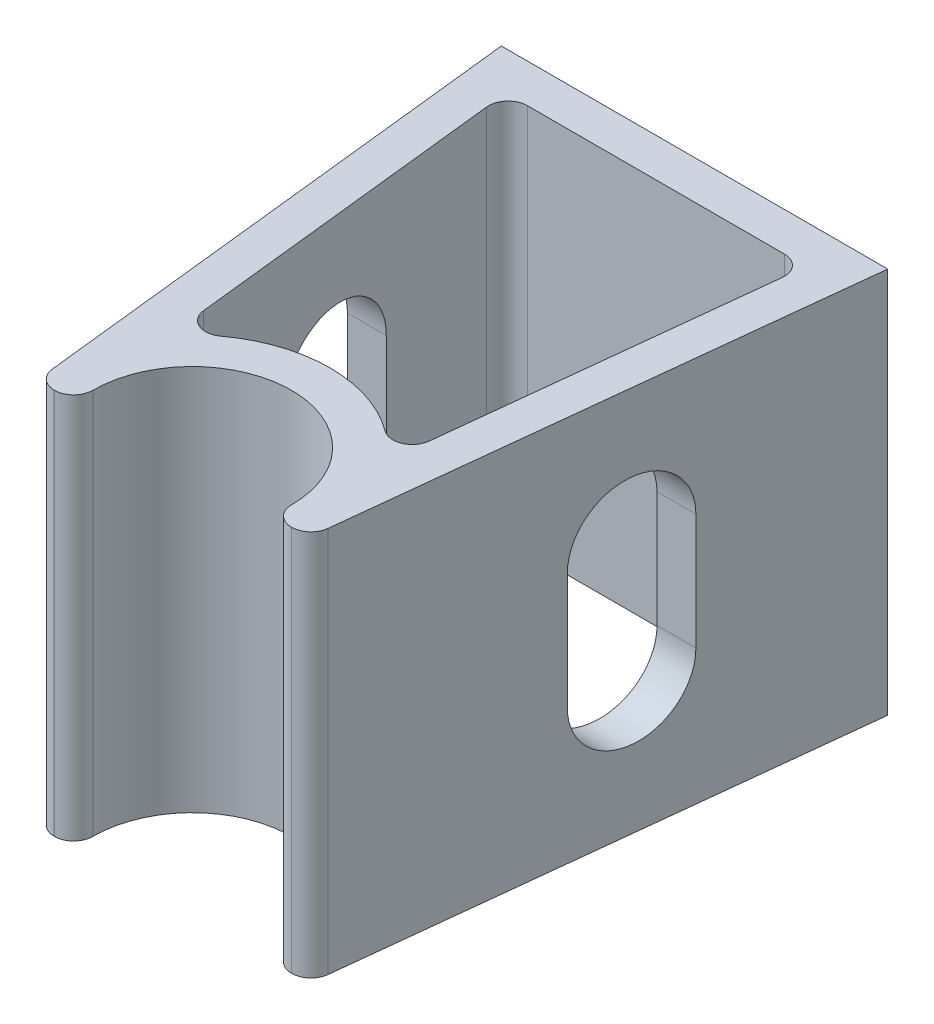
from build123d import *

# Parameters (mm, degrees)
BOSS_EXTRUDE1_DEPTH     = 50
CUT_EXTRUDE1_DEPTH      = 86.732140997
CUT_EXTRUDE1_DEPTH_BACK = 86.732140997
FILLET2_R               = 2.5
CUT_EXTRUDE2_DEPTH      = 86.732140997
CUT_EXTRUDE2_DEPTH_BACK = 86.732140997
SKETCH4_W               = 0.314102564
SKETCH4_H               = 2.557692308
BOSS_EXTRUDE2_DEPTH     = 1


with BuildPart() as part:
    # Sketch1 → Boss-Extrude1 (new body)
    with BuildSketch(Plane(origin=(0, 0, 0), x_dir=(1, 0, 0), z_dir=(0, 1, 0))):
        with BuildLine():
            Line((-12.6, -2.5), (-17.6, -2.5))
            Line((-17.6, -2.5), (-25, 65))
            Line((-25, 65), (25, 65))
            Line((25, 65), (17.6, -2.5))
            Line((17.6, -2.5), (12.6, -2.5))
            ThreePointArc((12.6, -2.5), (0, 12.845621822), (-12.6, -2.5))
        make_face()
    extrude(amount=BOSS_EXTRUDE1_DEPTH)

    # Sketch2 → Cut-Extrude1 (cut, two sides: drawn at the far end of the back side and taken through both)
    with BuildSketch(Plane(origin=(0, 50, 0), x_dir=(1, 0, 0), z_dir=(0, 1, 0)).offset(-CUT_EXTRUDE1_DEPTH_BACK)):
        with BuildLine():
            Line((14.050316299, 11.002491996), (19.421894954, 60))
            Line((19.421894954, 60), (-19.421894954, 60))
            Line((-19.421894954, 60), (-14.050316299, 11.002491996))
            ThreePointArc((-14.050316299, 11.002491996), (0, 17.845621822), (14.050316299, 11.002491996))
        make_face()
    extrude(amount=CUT_EXTRUDE1_DEPTH + CUT_EXTRUDE1_DEPTH_BACK, mode=Mode.SUBTRACT)

    # Fillet2
    fillet2_edges = [part.edges().sort_by_distance(p)[0] for p in [
        (-19.421894954, 25, -60),
        (19.421894954, 25, -60),
        (14.050316299, 25, -11.002491996),
        (-14.050316299, 25, -11.002491996),
        (17.6, 25, 2.5),
        (12.6, 25, 2.5),
        (-17.6, 25, 2.5),
        (-12.6, 25, 2.5),
    ]]
    fillet(fillet2_edges, radius=FILLET2_R)

    # Sketch3 → Cut-Extrude2 (cut, two sides: drawn at the far end of the back side and taken through both)
    with BuildSketch(Plane(origin=(0, 0, 0), x_dir=(0, 0, -1), z_dir=(1, 0, 0)).offset(-CUT_EXTRUDE2_DEPTH_BACK)):
        with BuildLine():
            Line((42.627558228, 32.5), (42.627558228, 17.5))
            ThreePointArc((42.627558228, 17.5), (35.127558228, 10), (27.627558228, 17.5))
            Line((27.627558228, 17.5), (27.627558228, 32.5))
            ThreePointArc((27.627558228, 32.5), (35.127558228, 40), (42.627558228, 32.5))
        make_face()
    extrude(amount=CUT_EXTRUDE2_DEPTH + CUT_EXTRUDE2_DEPTH_BACK, mode=Mode.SUBTRACT)

    # Sketch4 → Boss-Extrude2 (add)
    # profile 1 of 6: a face of its own
    with BuildSketch(Plane(origin=(0, 0, -65), x_dir=(-1, 0, 0), z_dir=(0, 0, -1))):
        Polygon((-5.077449232, 23.149296718), (-4.763346668, 23.149296718), (-4.763346668, 21.073976205), (-3.598783367, 22.117245436), (-3.147962053, 22.117245436), (-4.49832263, 20.905706975), (-3.013346668, 19.559553128), (-3.464167982, 19.559553128), (-4.763346668, 20.738138866), (-4.763346668, 19.559553128), (-5.077449232, 19.559553128), align=None)
    # profile 2 of 6: a face of its own
    with BuildSketch(Plane(origin=(0, 0, -65), x_dir=(-1, 0, 0), z_dir=(0, 0, -1))):
        with BuildLine():
            Line((-0.051808206, 22.117245436), (-0.051808206, 19.559553128))
            Line((-0.051808206, 19.559553128), (-0.365910771, 19.559553128))
            Line((-0.365910771, 19.559553128), (-0.365910771, 20.001960981))
            add(Edge.make_bspline(
                [(-0.365910771, 20.001960981), (-0.401329561, 19.961921387), (-0.470449776, 19.883783616), (-0.585890894, 19.781701443), (-0.708259072, 19.697323122), (-0.836960393, 19.629173206), (-0.971878637, 19.57798115), (-1.112714724, 19.541594991), (-1.259526105, 19.518201156), (-1.35977846, 19.515865134), (-1.410582245, 19.514681334)],
                knots=[0, 0, 0, 0, 1.074387032, 2.096679803, 3.090159297, 4.057316773, 5.018401886, 5.985159533, 6.978961417, 8, 8, 8, 8], degree=3))
            add(Edge.make_bspline(
                [(-1.410582245, 19.514681334), (-1.455750199, 19.515907706), (-1.544823404, 19.518326166), (-1.675852481, 19.53708847), (-1.80194473, 19.567219092), (-1.923219303, 19.609119981), (-2.038891448, 19.664700803), (-2.149951545, 19.731242051), (-2.255824237, 19.810482881), (-2.354895776, 19.901070909), (-2.446127776, 19.999465896), (-2.526189049, 20.104411443), (-2.592942129, 20.215453747), (-2.64876221, 20.331186901), (-2.691758554, 20.452501821), (-2.721732188, 20.578978988), (-2.740472635, 20.710468862), (-2.742890096, 20.800008385), (-2.744115899, 20.8454105)],
                knots=[0, 0, 0, 0, 1.033919861, 2.038935746, 3.024066025, 3.998881131, 4.97069526, 5.957263378, 6.95902576, 7.993208707, 9.027059324, 10.027763471, 11.009749337, 11.988697705, 12.965288445, 13.950418724, 14.960734635, 16, 16, 16, 16], degree=3))
            add(Edge.make_bspline(
                [(-2.744115899, 20.8454105), (-2.742862927, 20.889874204), (-2.740385871, 20.977776547), (-2.721932651, 21.107055245), (-2.690901642, 21.231573506), (-2.647353794, 21.350930449), (-2.591511839, 21.465270499), (-2.523583752, 21.574674524), (-2.443564628, 21.679443922), (-2.351312221, 21.777115149), (-2.251377451, 21.867335763), (-2.14446872, 21.945744808), (-2.033245438, 22.013461657), (-1.915982428, 22.067115133), (-1.794415323, 22.110524238), (-1.667461877, 22.140557206), (-1.535650299, 22.158254527), (-1.446159806, 22.160817291), (-1.40076654, 22.162117231)],
                knots=[0, 0, 0, 0, 1.020392517, 2.01726096, 2.990465484, 3.961182959, 4.928053699, 5.906110375, 6.912531644, 7.948652711, 8.985773172, 9.998621852, 10.987621588, 11.969261332, 12.953316658, 13.946091881, 14.958173133, 16, 16, 16, 16], degree=3))
            add(Edge.make_bspline(
                [(-1.40076654, 22.162117231), (-1.348566681, 22.160679479), (-1.246205221, 22.157860117), (-1.096477211, 22.134397389), (-0.954832734, 22.094758922), (-0.820178382, 22.040841424), (-0.692997695, 21.969192695), (-0.574494711, 21.878812734), (-0.463429228, 21.770271547), (-0.399048936, 21.686901103), (-0.365910771, 21.643988225)],
                knots=[0, 0, 0, 0, 1.038897134, 2.037228247, 3.008116434, 3.962042015, 4.918381754, 5.904844433, 6.921570401, 8, 8, 8, 8], degree=3))
            Line((-0.365910771, 21.643988225), (-0.365910771, 22.117245436))
            Line((-0.365910771, 22.117245436), (-0.051808206, 22.117245436))
        make_face()
        with BuildLine():
            add(Edge.make_bspline(
                [(-1.396559809, 21.848014667), (-1.442474147, 21.846381029), (-1.533101747, 21.843156488), (-1.666145749, 21.817982993), (-1.793459163, 21.776098399), (-1.914405237, 21.718816497), (-2.027073454, 21.646787761), (-2.127767125, 21.559666378), (-2.217309826, 21.459829363), (-2.29261809, 21.347727253), (-2.354008587, 21.227549162), (-2.397175619, 21.101924724), (-2.425644867, 20.973119746), (-2.428553387, 20.88575706), (-2.430013335, 20.841904891)],
                knots=[0, 0, 0, 0, 1.031046209, 2.035121221, 3.029706178, 4.034933723, 5.034054252, 6.02443088, 7.017295772, 8.038157696, 9.050218397, 10.03989886, 11.016116709, 12, 12, 12, 12], degree=3))
            add(Edge.make_bspline(
                [(-2.430013335, 20.841904891), (-2.428148441, 20.798314784), (-2.424425964, 20.711305428), (-2.39767527, 20.582324851), (-2.352795397, 20.456670809), (-2.291553334, 20.335409816), (-2.214866709, 20.222825716), (-2.125978057, 20.121085593), (-2.024027775, 20.033596005), (-1.911100268, 19.960358431), (-1.790492298, 19.90119591), (-1.663658366, 19.860030271), (-1.532982728, 19.83345249), (-1.444130394, 19.830348013), (-1.399364296, 19.828783898)],
                knots=[0, 0, 0, 0, 0.979072187, 1.954306742, 2.945804271, 3.96968567, 4.997920485, 5.998718438, 6.996577872, 8.005894225, 9.015743152, 10.005417472, 10.995077863, 12, 12, 12, 12], degree=3))
            add(Edge.make_bspline(
                [(-1.399364296, 19.828783898), (-1.353917793, 19.830443862), (-1.263529207, 19.833745365), (-1.130090499, 19.859026631), (-1.000595536, 19.900795429), (-0.876808308, 19.958694556), (-0.761492177, 20.030451911), (-0.657994299, 20.114459003), (-0.570478331, 20.212162187), (-0.496285721, 20.31953864), (-0.438110304, 20.437250636), (-0.395734245, 20.562584827), (-0.370680339, 20.695545575), (-0.36752261, 20.786409502), (-0.365910771, 20.832790308)],
                knots=[0, 0, 0, 0, 1.01762866, 2.023962475, 3.030623092, 4.058876274, 5.077231937, 6.066672613, 7.034107872, 8.005628644, 8.981990164, 9.965428785, 10.961468474, 12, 12, 12, 12], degree=3))
            add(Edge.make_bspline(
                [(-0.365910771, 20.832790308), (-0.366870427, 20.868128138), (-0.368759334, 20.937684172), (-0.383189904, 21.039811689), (-0.40614483, 21.137545415), (-0.438491, 21.230988104), (-0.480982285, 21.31962312), (-0.532230051, 21.40408688), (-0.5931355, 21.483940091), (-0.662718196, 21.558083162), (-0.738883399, 21.625709625), (-0.81947794, 21.686073865), (-0.905456687, 21.735662638), (-0.995373723, 21.77670391), (-1.089385058, 21.80936306), (-1.188255678, 21.831150753), (-1.290934665, 21.846111074), (-1.36098072, 21.847373455), (-1.396559809, 21.848014667)],
                knots=[0, 0, 0, 0, 1.050140795, 2.067009409, 3.05949893, 4.030605086, 5.00011959, 5.97591094, 6.962425594, 7.979863591, 8.993523472, 9.986985069, 10.967611495, 11.937549037, 12.921786183, 13.919465291, 14.943216303, 16, 16, 16, 16], degree=3))
        make_face(mode=Mode.SUBTRACT)
    # profile 3 of 6: a face of its own
    with BuildSketch(Plane(origin=(0, 0, -65), x_dir=(-1, 0, 0), z_dir=(0, 0, -1))):
        Polygon((0.307166153, 22.117245436), (0.643704614, 22.117245436), (1.406525127, 20.277501846), (2.240158941, 22.117245436), (2.294145319, 22.117245436), (3.111653332, 20.277501846), (3.880783941, 22.117245436), (4.211012306, 22.117245436), (3.141801569, 19.559553128), (3.077298364, 19.559553128), (2.259089229, 21.399296718), (1.425455415, 19.559553128), (1.367963428, 19.559553128), align=None)
    # profile 4 of 6: a face of its own
    with BuildSketch(Plane(origin=(0, 0, -65), x_dir=(-1, 0, 0), z_dir=(0, 0, -1))):
        with BuildLine():
            add(Edge.make_bspline(
                [(4.725635704, 23.194168513), (4.74512702, 23.193264361), (4.783294759, 23.191493857), (4.838488027, 23.17633238), (4.888745039, 23.150632694), (4.933322772, 23.116153013), (4.971574659, 23.07560357), (4.998355369, 23.028342601), (5.015567765, 22.977283963), (5.017646321, 22.941668873), (5.018704614, 22.9235355)],
                knots=[0, 0, 0, 0, 1.055194115, 2.066272739, 3.074728998, 4.095836921, 5.109056067, 6.073838105, 7.019297344, 8, 8, 8, 8], degree=3))
            add(Edge.make_bspline(
                [(5.018704614, 22.9235355), (5.017622454, 22.905872847), (5.015483152, 22.870955872), (4.998368664, 22.8207824), (4.971346426, 22.774178117), (4.933347301, 22.733707406), (4.88873854, 22.699246786), (4.838489754, 22.673542047), (4.783294305, 22.65838191), (4.745126866, 22.656611221), (4.725635704, 22.655706975)],
                knots=[0, 0, 0, 0, 0.96129708, 1.900370562, 2.859976407, 3.87933698, 4.906634145, 5.921202961, 6.938410037, 8, 8, 8, 8], degree=3))
            add(Edge.make_bspline(
                [(4.725635704, 22.655706975), (4.706367429, 22.656576695), (4.668864248, 22.658269492), (4.614497406, 22.673839509), (4.564668917, 22.699255582), (4.520004244, 22.733481768), (4.482774051, 22.774426665), (4.455675726, 22.820753959), (4.438600764, 22.870963113), (4.436456135, 22.90587528), (4.435371281, 22.9235355)],
                knots=[0, 0, 0, 0, 1.054934014, 2.053291228, 3.073705704, 4.106921865, 5.123545215, 6.088680038, 7.033164197, 8, 8, 8, 8], degree=3))
            add(Edge.make_bspline(
                [(4.435371281, 22.9235355), (4.436432367, 22.94166635), (4.438516408, 22.977276482), (4.455688525, 23.028371515), (4.482548332, 23.075353017), (4.520028896, 23.116378517), (4.564662356, 23.150623951), (4.614499101, 23.176034933), (4.668863801, 23.191606272), (4.706367277, 23.193298887), (4.725635704, 23.194168513)],
                knots=[0, 0, 0, 0, 0.98631895, 1.937192651, 2.907499808, 3.917963147, 4.944918757, 5.95915025, 6.951458133, 8, 8, 8, 8], degree=3))
        make_face()
    # profile 5 of 6: a face of its own
    with BuildSketch(Plane(origin=(0, 0, -65), x_dir=(-1, 0, 0), z_dir=(0, 0, -1))):
        with Locations((4.727037947, 20.838399282)):
            Rectangle(SKETCH4_W, SKETCH4_H)
    # profile 6 of 6: a face of its own
    with BuildSketch(Plane(origin=(0, 0, -65), x_dir=(-1, 0, 0), z_dir=(0, 0, -1))):
        with BuildLine():
            Line((5.646909742, 22.117245436), (5.961012306, 22.117245436))
            Line((5.961012306, 22.117245436), (5.961012306, 21.655907295))
            add(Edge.make_bspline(
                [(5.961012306, 21.655907295), (5.994549942, 21.697750018), (6.059630893, 21.778947281), (6.168015226, 21.885667856), (6.282559126, 21.973613081), (6.40256113, 22.043716875), (6.52818414, 22.096563501), (6.65866241, 22.134729432), (6.794777116, 22.157614261), (6.887341553, 22.160604491), (6.934169358, 22.162117231)],
                knots=[0, 0, 0, 0, 1.12780773, 2.188550248, 3.19190651, 4.159438251, 5.104880172, 6.052711206, 7.014878035, 8, 8, 8, 8], degree=3))
            add(Edge.make_bspline(
                [(6.934169358, 22.162117231), (6.981499992, 22.160372036), (7.07413746, 22.156956267), (7.209015521, 22.129939576), (7.334988915, 22.083794321), (7.45160847, 22.02058225), (7.556735684, 21.941975777), (7.649060535, 21.850397995), (7.725423783, 21.745061912), (7.776621146, 21.647338756), (7.810346793, 21.560649962), (7.831579131, 21.486403211), (7.849610112, 21.40368506), (7.86524186, 21.312745471), (7.875818972, 21.212947281), (7.884161264, 21.104699589), (7.890139958, 20.988037458), (7.890377165, 20.907350831), (7.890499486, 20.865743032)],
                knots=[0, 0, 0, 0, 1.235846778, 2.418850247, 3.575807741, 4.728682307, 5.871620074, 6.994088408, 8.11269785, 9.256955736, 9.865816715, 10.540099792, 11.271859618, 12.076849838, 12.949306005, 13.892391288, 14.913166135, 16, 16, 16, 16], degree=3))
            Line((7.890499486, 20.865743032), (7.890499486, 19.559553128))
            Line((7.890499486, 19.559553128), (7.576396922, 19.559553128))
            Line((7.576396922, 19.559553128), (7.576396922, 20.762678128))
            add(Edge.make_bspline(
                [(7.576396922, 20.762678128), (7.576203714, 20.797500573), (7.57583414, 20.864109984), (7.574668493, 20.959479007), (7.571858686, 21.045965586), (7.567910373, 21.123362953), (7.562131343, 21.19159679), (7.556108712, 21.250806066), (7.548743735, 21.300915609), (7.542180822, 21.331080691), (7.539237467, 21.344609218)],
                knots=[0, 0, 0, 0, 1.430800155, 2.736877192, 3.918605307, 4.986035426, 5.920637409, 6.731861385, 7.431261377, 8, 8, 8, 8], degree=3))
            add(Edge.make_bspline(
                [(7.539237467, 21.344609218), (7.528611935, 21.384320403), (7.508161074, 21.460752148), (7.457627091, 21.5644265), (7.393812911, 21.652624688), (7.315915061, 21.72480141), (7.224685986, 21.780972247), (7.120378843, 21.819946201), (7.004000202, 21.84432247), (6.922145819, 21.846749602), (6.879481858, 21.848014667)],
                knots=[0, 0, 0, 0, 1.084156227, 2.086665306, 3.027808233, 3.945421172, 4.874247719, 5.839848303, 6.874090471, 8, 8, 8, 8], degree=3))
            add(Edge.make_bspline(
                [(6.879481858, 21.848014667), (6.854214174, 21.847538662), (6.804210081, 21.846596661), (6.730060109, 21.837145363), (6.658135936, 21.821686908), (6.587715727, 21.80081827), (6.520207933, 21.772156001), (6.453443642, 21.739626631), (6.389936878, 21.699078419), (6.328333481, 21.653887797), (6.271020673, 21.60380859), (6.217692335, 21.55096408), (6.170154314, 21.494688476), (6.127085639, 21.435888529), (6.089907376, 21.373756691), (6.057454288, 21.308892384), (6.029918593, 21.241210235), (6.016235901, 21.194235174), (6.00938971, 21.170731013)],
                knots=[0, 0, 0, 0, 1.023777757, 2.026029729, 3.023749952, 4.003683103, 4.997618607, 5.993177895, 7.010360494, 8.046726602, 9.087585522, 10.09234134, 11.086953743, 12.070360549, 13.043493632, 14.017870808, 15.008233677, 16, 16, 16, 16], degree=3))
            add(Edge.make_bspline(
                [(6.00938971, 21.170731013), (6.005450062, 21.15347581), (5.996873653, 21.115912136), (5.987610473, 21.054267716), (5.979202898, 20.982957741), (5.972165939, 20.902065424), (5.967860522, 20.811307549), (5.963166126, 20.711071711), (5.961457065, 20.600958223), (5.961164711, 20.52429653), (5.961012306, 20.484332776)],
                knots=[0, 0, 0, 0, 0.615963638, 1.340920617, 2.168419149, 3.115676021, 4.16674242, 5.331190069, 6.6087489, 8, 8, 8, 8], degree=3))
            Line((5.961012306, 20.484332776), (5.961012306, 19.559553128))
            Line((5.961012306, 19.559553128), (5.646909742, 19.559553128))
            Line((5.646909742, 19.559553128), (5.646909742, 22.117245436))
        make_face()
    extrude(amount=BOSS_EXTRUDE2_DEPTH)


solid = part.part
